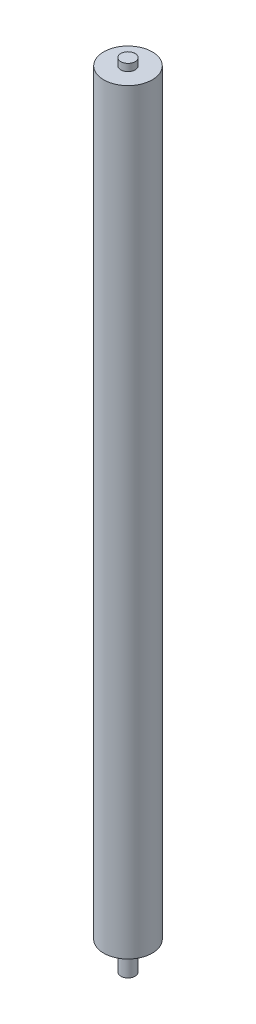
from build123d import *

# Parameters (mm, degrees)
SKETCH1_R           = 10
BOSS_EXTRUDE1_DEPTH = 40
SKETCH2_R           = 34
BOSS_EXTRUDE2_DEPTH = 1060
SKETCH3_R           = 10
BOSS_EXTRUDE3_DEPTH = 10


with BuildPart() as part:
    # Sketch1 → Boss-Extrude1 (new body)
    with BuildSketch(Plane(origin=(0, 0, 0), x_dir=(1, 0, 0), z_dir=(0, 1, 0))):
        Circle(SKETCH1_R)
    extrude(amount=BOSS_EXTRUDE1_DEPTH)

    # Sketch2 → Boss-Extrude2 (add)
    with BuildSketch(Plane(origin=(0, 40, 0), x_dir=(1, 0, 0), z_dir=(0, 1, 0))):
        Circle(SKETCH2_R)
    extrude(amount=BOSS_EXTRUDE2_DEPTH)

    # Sketch3 → Boss-Extrude3 (add)
    with BuildSketch(Plane(origin=(0, 1100, 0), x_dir=(1, 0, 0), z_dir=(0, 1, 0))):
        Circle(SKETCH3_R)
    extrude(amount=BOSS_EXTRUDE3_DEPTH)


solid = part.part
